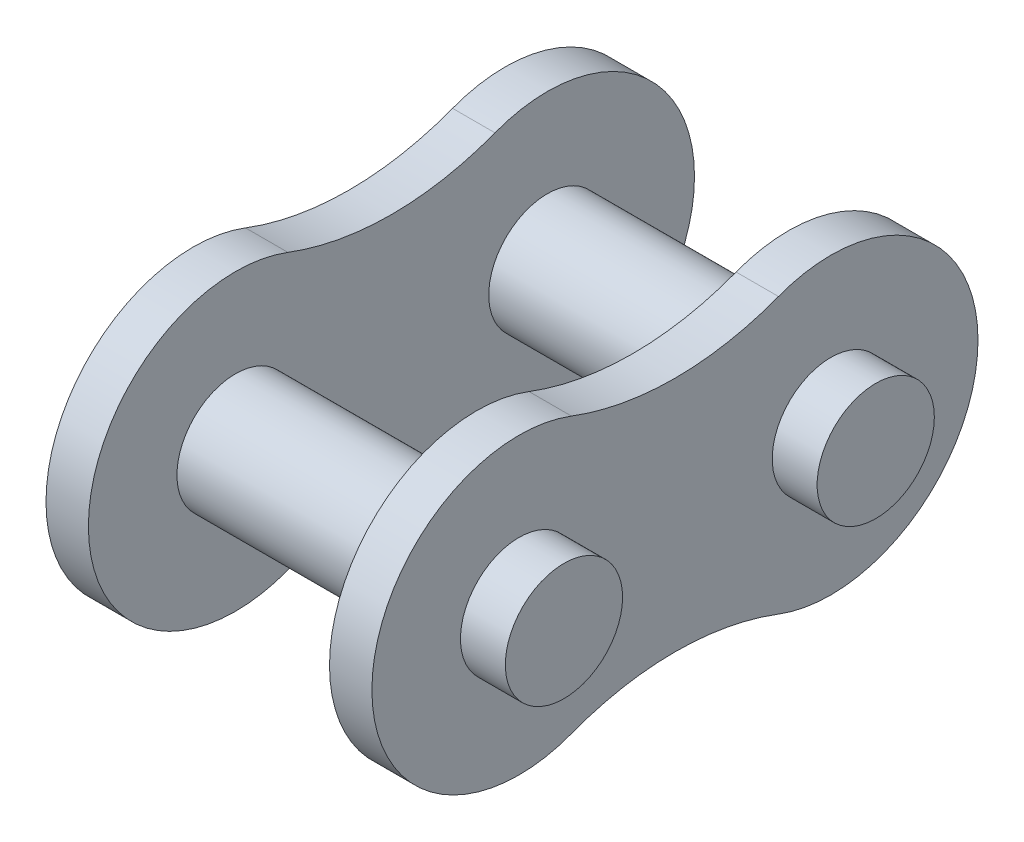
from build123d import *

# Parameters (mm, degrees)
SKETCH1_R             = 1.7907
BOSS_EXTRUDE1_DEPTH   = 6.35
BOSS_EXTRUDE1_2_DEPTH = 6.35
BOSS_EXTRUDE2_START   = 3.683
BOSS_EXTRUDE2_DEPTH   = 1.2954
BOSS_EXTRUDE3_START   = -3.683
SKETCH1_5_R           = 1.7907
BOSS_EXTRUDE3_DEPTH   = 1.2954


with BuildPart() as part:
    # Sketch1 → Boss-Extrude1 (new, symmetric)
    with BuildSketch(Plane(origin=(0, 0, 0), x_dir=(0, 0, -1), z_dir=(1, 0, 0))):
        with Locations((9.525, 0)):
            Circle(SKETCH1_R)
    extrude(amount=BOSS_EXTRUDE1_DEPTH, both=True)


with BuildPart() as body_2:
    # Sketch1 → Boss-Extrude1 2 (new, symmetric)
    with BuildSketch(Plane(origin=(0, 0, 0), x_dir=(0, 0, -1), z_dir=(1, 0, 0))):
        Circle(SKETCH1_R)
    extrude(amount=BOSS_EXTRUDE1_2_DEPTH, both=True)


with BuildPart() as body_3:
    # Sketch1<4> → Boss-Extrude2 (new body)
    with BuildSketch(Plane(origin=(0, 0, 0), x_dir=(0, 0, -1), z_dir=(1, 0, 0)).offset(BOSS_EXTRUDE2_START)):
        with BuildLine():
            ThreePointArc((7.925450664, 4.201625824), (4.7625, 3.619925475), (1.599549336, 4.201625824))
            ThreePointArc((1.599549336, 4.201625824), (-4.4958, 0), (1.599549336, -4.201625824))
            ThreePointArc((1.599549336, -4.201625824), (4.7625, -3.619925475), (7.925450664, -4.201625824))
            ThreePointArc((7.925450664, -4.201625824), (14.0208, 0), (7.925450664, 4.201625824))
        make_face()
    extrude(amount=BOSS_EXTRUDE2_DEPTH)


with BuildPart() as body_4:
    # Sketch1<5> → Boss-Extrude3 (new body)
    with BuildSketch(Plane(origin=(0, 0, 0), x_dir=(0, 0, -1), z_dir=(1, 0, 0)).offset(BOSS_EXTRUDE3_START)):
        with BuildLine():
            ThreePointArc((7.925450664, 4.201625824), (4.7625, 3.619925475), (1.599549336, 4.201625824))
            ThreePointArc((1.599549336, 4.201625824), (-4.4958, 0), (1.599549336, -4.201625824))
            ThreePointArc((1.599549336, -4.201625824), (4.7625, -3.619925475), (7.925450664, -4.201625824))
            ThreePointArc((7.925450664, -4.201625824), (14.0208, 0), (7.925450664, 4.201625824))
        make_face()
        Circle(SKETCH1_5_R, mode=Mode.SUBTRACT)
        with Locations((9.525, 0)):
            Circle(SKETCH1_5_R, mode=Mode.SUBTRACT)
    extrude(amount=-BOSS_EXTRUDE3_DEPTH)


solid = Compound([part.part, body_2.part, body_3.part, body_4.part])
